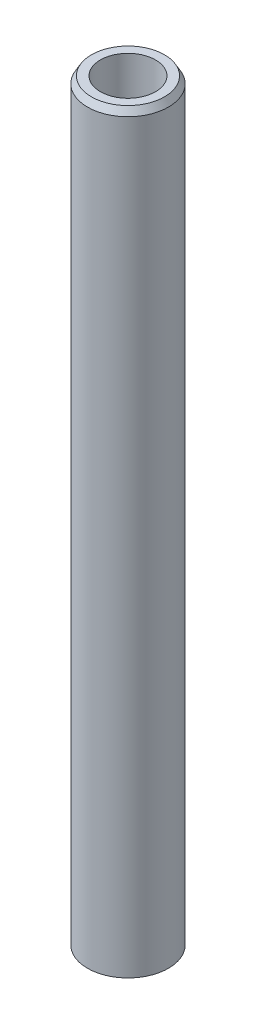
from build123d import *
from OCP.BRepFilletAPI import BRepFilletAPI_MakeChamfer

# Parameters (mm, degrees)
SKETCH1_R           = 30
BOSS_EXTRUDE1_DEPTH = 561.014777907
SKETCH2_R           = 20.444552229
CUT_EXTRUDE1_DEPTH  = 563.616726583
CHAMFER1_SIZE       = 5.096847701
CHAMFER1_SIZE2      = 2.942666392


with BuildPart() as part:
    # Sketch1 → Boss-Extrude1 (new body)
    with BuildSketch(Plane(origin=(0, 0, 0), x_dir=(1, 0, 0), z_dir=(0, 1, 0))):
        Circle(SKETCH1_R)
    extrude(amount=BOSS_EXTRUDE1_DEPTH)

    # Sketch2 → Cut-Extrude1 (cut, through all)
    with BuildSketch(Plane(origin=(0, 0, 0), x_dir=(1, 0, 0), z_dir=(0, 1, 0))):
        Circle(SKETCH2_R)
    extrude(amount=CUT_EXTRUDE1_DEPTH, mode=Mode.SUBTRACT)

    # Chamfer1: one chamfer whose edges measure the first distance from different faces: ONE call of the kernel's chamfer builder (chamfer() names one face for all edges)
    chamfer1_edges_1 = [part.edges().sort_by_distance(p)[0] for p in [
        (-30, 561.014777907, 0),
    ]]
    chamfer1_side_1 = [part.faces().sort_by_distance(p)[0] for p in [
        (-30, 280.507388954, 0),
    ]]
    chamfer1_edges_2 = [part.edges().sort_by_distance(p)[0] for p in [
        (-30, 0, 0),
    ]]
    chamfer1_side_2 = [part.faces().sort_by_distance(p)[0] for p in [
        (-29.151471863, 0, 0),
    ]]
    chamfer1 = BRepFilletAPI_MakeChamfer(part.part.solid().wrapped)
    for e in chamfer1_edges_1:
        chamfer1.Add(CHAMFER1_SIZE, CHAMFER1_SIZE2, e.wrapped, chamfer1_side_1[0].wrapped)  # the first distance lies on this face
    for e in chamfer1_edges_2:
        chamfer1.Add(CHAMFER1_SIZE, CHAMFER1_SIZE2, e.wrapped, chamfer1_side_2[0].wrapped)  # the first distance lies on this face
    add(Compound.cast(chamfer1.Shape()), mode=Mode.REPLACE)


solid = part.part
